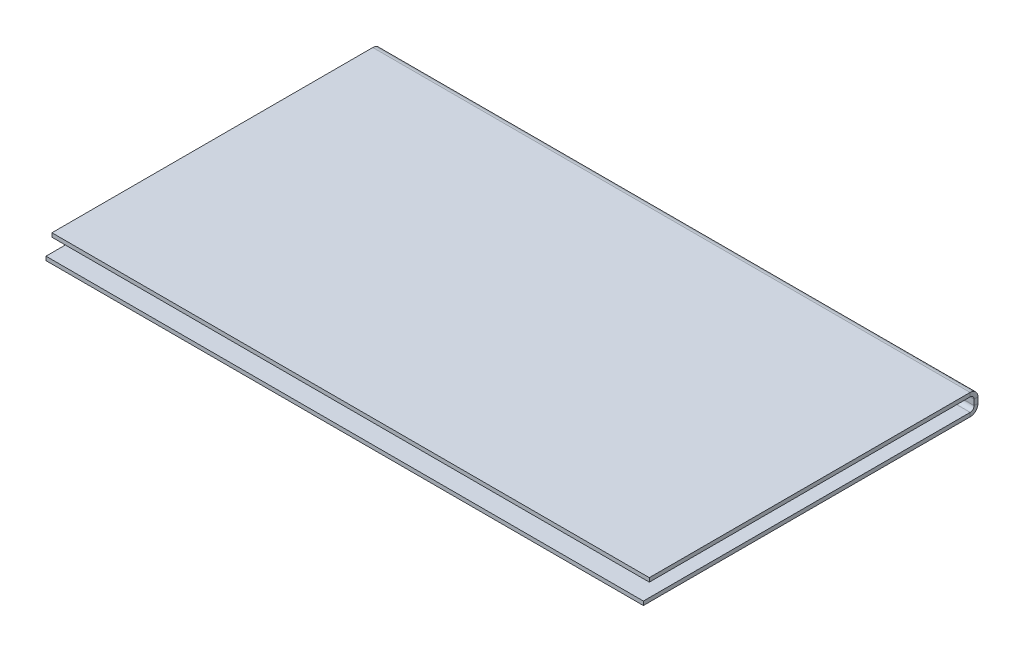
from build123d import *

# Parameters (mm, degrees)
SKETCH1_W                    = 112.686822752
SKETCH1_H                    = 63.120861651
SKETCH1_R                    = 5.443424695
BASE_FLANGE1_DEPTH           = 0.7366
EDGE_FLANGE1_STRIP_W         = 4.4196
EDGE_FLANGE1_STRIP_H         = 0.7366
EDGE_FLANGE1_STRIP_CUT_DEPTH = 112.686822752
EDGE_FLANGE1_DEPTH           = 112.686822752
EDGE_FLANGE2_STRIP_W         = 4.4196
EDGE_FLANGE2_STRIP_H         = 0.7366
EDGE_FLANGE2_STRIP_CUT_DEPTH = 112.686822752
EDGE_FLANGE2_DEPTH           = 112.686822752


# Sheet-metal steps are written as plain solids
with BuildPart() as part:
    # Sketch1 → Base-Flange1 (new body)
    with BuildSketch(Plane(origin=(0, 0, 0), x_dir=(1, 0, 0), z_dir=(0, 1, 0))):
        with Locations((56.343411376, 31.560430826)):
            Rectangle(SKETCH1_W, SKETCH1_H)
        with Locations(Location((50.380635498, 49.990828995, 0), (0, 0, 270))):
            Circle(SKETCH1_R, mode=Mode.SUBTRACT)
        with Locations(Location((50.380635498, 13.130032656, 0), (0, 0, 90))):
            Circle(SKETCH1_R, mode=Mode.SUBTRACT)
    extrude(amount=-BASE_FLANGE1_DEPTH)

    # Edge-Flange1 strip (across the edge) → Edge-Flange1 strip cut (cut)
    with BuildSketch(Plane(origin=(112.686822752, 0, -63.120861651), x_dir=(0, 0, 1), z_dir=(-1, 0, 0))):
        with Locations((-0.7366, -0.3683)):
            Rectangle(EDGE_FLANGE1_STRIP_W, EDGE_FLANGE1_STRIP_H)
    extrude(amount=EDGE_FLANGE1_STRIP_CUT_DEPTH, mode=Mode.SUBTRACT)

    # Edge-Flange1 section (across the edge) → Edge-Flange1 (add)
    with BuildSketch(Plane(origin=(112.686822752, 0, -63.120861651), x_dir=(0, 0, 1), z_dir=(-1, 0, 0))):
        with BuildLine():
            Line((0, 0.7366), (0, 3.2634))
            Line((0, 3.2634), (0.7366, 3.2634))
            Line((0.7366, 3.2634), (0.7366, 0.7366))
            ThreePointArc((0.7366, 0.7366), (0.952345145, 0.215745145), (1.4732, 0))
            Line((1.4732, 0), (1.4732, -0.7366))
            ThreePointArc((1.4732, -0.7366), (0.43149029, -0.30510971), (0, 0.7366))
        make_face()
    extrude(amount=EDGE_FLANGE1_DEPTH)

    # Edge-Flange2 strip (across the edge) → Edge-Flange2 strip cut (cut)
    with BuildSketch(Plane(origin=(112.686822752, 3.2634, -62.384261651), x_dir=(0, -1, 0), z_dir=(-1, 0, 0))):
        with Locations((-0.7366, -0.3683)):
            Rectangle(EDGE_FLANGE2_STRIP_W, EDGE_FLANGE2_STRIP_H)
    extrude(amount=EDGE_FLANGE2_STRIP_CUT_DEPTH, mode=Mode.SUBTRACT)

    # Edge-Flange2 section (across the edge) → Edge-Flange2 (add)
    with BuildSketch(Plane(origin=(112.686822752, 3.2634, -62.384261651), x_dir=(0, -1, 0), z_dir=(-1, 0, 0))):
        with BuildLine():
            Line((0, 0.7366), (0, 61.2634))
            Line((0, 61.2634), (0.7366, 61.2634))
            Line((0.7366, 61.2634), (0.7366, 0.7366))
            ThreePointArc((0.7366, 0.7366), (0.952345145, 0.215745145), (1.4732, 0))
            Line((1.4732, 0), (1.4732, -0.7366))
            ThreePointArc((1.4732, -0.7366), (0.43149029, -0.30510971), (0, 0.7366))
        make_face()
    extrude(amount=EDGE_FLANGE2_DEPTH)


solid = part.part
